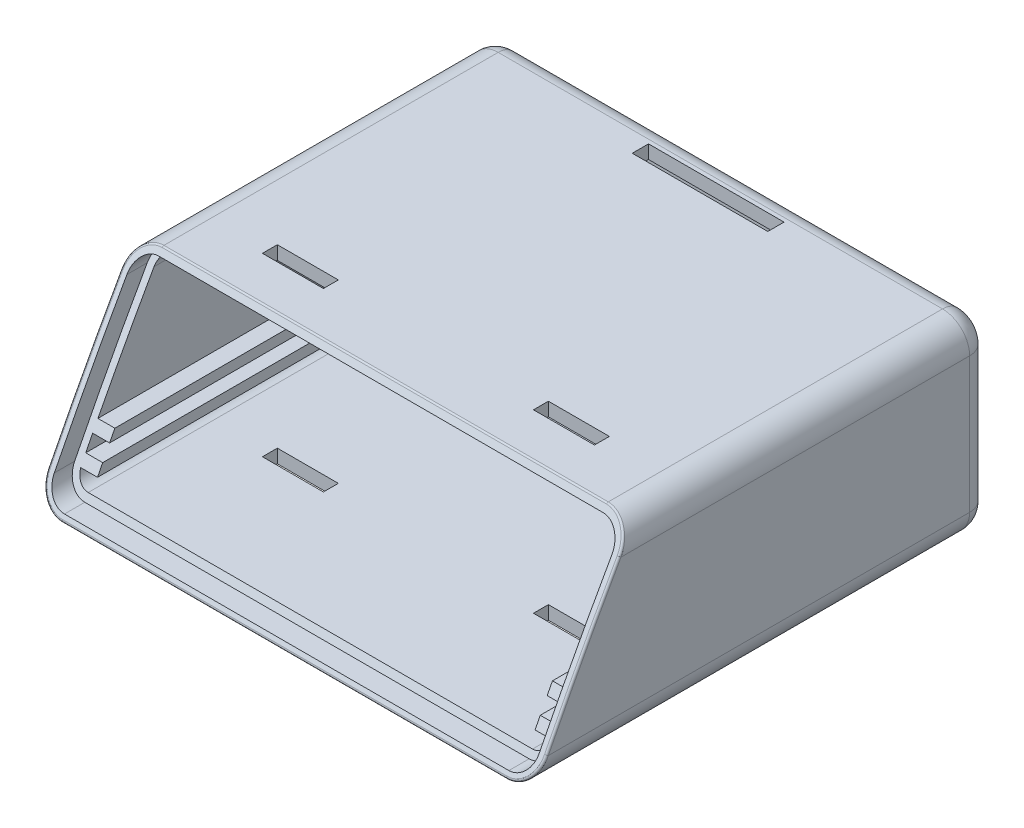
from build123d import *
from OCP.BRepAlgoAPI import BRepAlgoAPI_Cut
from OCP.TopTools import TopTools_ListOfShape

# Parameters (mm, degrees)
SKETCH1_W                = 73.58
SKETCH1_H                = 67.5
BOSS_EXTRUDE1_DEPTH      = 28
FILLET1_R                = 4
SHELL1_T                 = -2
CUT_EXTRUDE1_DEPTH       = 86.656750464
FILLET2_R                = 3
CUT_EXTRUDE3_REACH       = 162.173
CUT_EXTRUDE3_END_RADIUS  = 475
CUT_EXTRUDE3_START       = 80
FILLET3_R                = 0.3
BOSS_EXTRUDE2_REACH      = 82.024
BOSS_EXTRUDE2_END_RADIUS = 475
SKETCH5_W                = 2.5
SKETCH5_H                = 1.5
SKETCH6_W                = 14.3
SKETCH6_H                = 16.7
SKETCH6_W_2              = 11.05
SKETCH6_H_2              = 14.049996967
CUT_EXTRUDE4_DEPTH       = 2
SKETCH7_W                = 9
SKETCH7_H                = 2.2
CUT_EXTRUDE5_DEPTH       = 58.241301636
SKETCH8_W                = 20
SKETCH8_H                = 2.4
CUT_EXTRUDE6_DEPTH       = 2


with BuildPart() as part:
    # Sketch1 → Boss-Extrude1 (new body)
    with BuildSketch(Plane(origin=(0, 0, 0), x_dir=(1, 0, 0), z_dir=(0, 1, 0))):
        Rectangle(SKETCH1_W, SKETCH1_H)
    extrude(amount=BOSS_EXTRUDE1_DEPTH)

    # Fillet1
    fillet1_edges = [part.edges().sort_by_distance(p)[0] for p in [
        (-36.79, 28, 0),
        (36.79, 28, 0),
        (-36.79, 0, 0),
        (36.79, 0, 0),
    ]]
    fillet(fillet1_edges, radius=FILLET1_R)

    # Shell1
    shell1_openings = [part.faces().sort_by_distance(p)[0] for p in [
        (0, 14, 33.75),
    ]]
    offset(amount=SHELL1_T, openings=shell1_openings, kind=Kind.INTERSECTION)


with BuildPart() as cut_extrude1_tool:
    # Sketch2 → Cut-Extrude1 (new, through all)
    with BuildSketch(Plane.ZY.offset(36.79)):
        with BuildLine():
            Line((18.75, 28), (33.75, 28))
            Line((33.75, 28), (33.75, 0))
            ThreePointArc((33.75, 0), (26.484121584, 14.125422277), (18.75, 28))
        make_face()
    extrude(amount=-CUT_EXTRUDE1_DEPTH)


with BuildPart() as part_1:
    add(part.part)

    # Cut-Extrude1: cut by cut_extrude1_tool, with a tolerance
    cut_extrude1_stock = TopTools_ListOfShape()
    cut_extrude1_stock.Append(part_1.part.wrapped)
    cut_extrude1_tools = TopTools_ListOfShape()
    cut_extrude1_tools.Append(cut_extrude1_tool.part.wrapped)
    cut_extrude1_cut = BRepAlgoAPI_Cut()
    cut_extrude1_cut.SetArguments(cut_extrude1_stock)
    cut_extrude1_cut.SetTools(cut_extrude1_tools)
    cut_extrude1_cut.SetFuzzyValue(0.00001)
    cut_extrude1_cut.Build()
    add(Compound.cast(cut_extrude1_cut.Shape()).solids(), mode=Mode.REPLACE)

    # Fillet2
    fillet2_edges = [part_1.edges().sort_by_distance(p)[0] for p in [
        (0, 28, -33.75),
        (0, 0, -33.75),
        (-36.79, 14, -33.75),
        (36.79, 14, -33.75),
        (-35.618427125, 26.828427125, -33.75),
        (-35.618427125, 1.171572875, -33.75),
        (35.618427125, 1.171572875, -33.75),
        (35.618427125, 26.828427125, -33.75),
    ]]
    fillet(fillet2_edges, radius=FILLET2_R)

    # Cut-Extrude3: up to this cylinder (the profile starts outside it)
    cut_extrude3_end = Plane(origin=(0, -210.179748667, -395.218864179), z_dir=(-1, 0, 0)) * Cylinder(CUT_EXTRUDE3_END_RADIUS, 1275.346, mode=Mode.PRIVATE)
    # Sketch4 → Cut-Extrude3 (cut, up to the surface)
    with BuildSketch(Plane.XY.offset(-31.75).offset(CUT_EXTRUDE3_START), mode=Mode.PRIVATE) as cut_extrude3_sk1:
        with BuildLine():
            Line((32.79, 27), (-32.79, 27))
            ThreePointArc((-32.79, 27), (-34.911320344, 26.121320344), (-35.79, 24))
            Line((-35.79, 24), (-35.79, 4))
            ThreePointArc((-35.79, 4), (-34.911320344, 1.878679656), (-32.79, 1))
            Line((-32.79, 1), (32.79, 1))
            ThreePointArc((32.79, 1), (34.911320344, 1.878679656), (35.79, 4))
            Line((35.79, 4), (35.79, 24))
            ThreePointArc((35.79, 24), (34.911320344, 26.121320344), (32.79, 27))
        make_face()
        with BuildLine():
            Line((32.79, 26), (-32.79, 26))
            ThreePointArc((-32.79, 26), (-34.204213562, 25.414213562), (-34.79, 24))
            Line((-34.79, 24), (-34.79, 4))
            ThreePointArc((-34.79, 4), (-34.204213562, 2.585786438), (-32.79, 2))
            Line((-32.79, 2), (32.79, 2))
            ThreePointArc((32.79, 2), (34.204213562, 2.585786438), (34.79, 4))
            Line((34.79, 4), (34.79, 24))
            ThreePointArc((34.79, 24), (34.204213562, 25.414213562), (32.79, 26))
        make_face(mode=Mode.SUBTRACT)
    cut_extrude3_tool1 = extrude(cut_extrude3_sk1.sketch, amount=-CUT_EXTRUDE3_REACH, mode=Mode.PRIVATE) - cut_extrude3_end
    add(cut_extrude3_tool1.solids().sort_by_distance((0, 26.238443, 48.25))[0], mode=Mode.SUBTRACT)

    # Fillet3
    fillet3_edges = [part_1.edges().sort_by_distance(p)[0] for p in [
        (0, 0, 33.75),
        (-36.79, 14.0639546, 26.517044891),
        (35.714985447, 26.728453829, 19.484309952),
        (35.696759777, 1.252137621, 33.12988385),
        (-35.696759776, 1.252137622, 33.12988385),
        (-35.714985447, 26.728453829, 19.484309952),
        (36.79, 14.0639546, 26.517044891),
        (0, 28, 18.75),
    ]]
    fillet(fillet3_edges, radius=FILLET3_R)

    # Boss-Extrude2: up to this cylinder (the profile starts inside it)
    boss_extrude2_end = Plane(origin=(0, -210.179748667, -395.218864179), z_dir=(-1, 0, 0)) * Cylinder(BOSS_EXTRUDE2_END_RADIUS, 1182.128, mode=Mode.PRIVATE)
    # Sketch5 → Boss-Extrude2 (add, up to the surface)
    with BuildSketch(Plane.XY.offset(-31.75), mode=Mode.PRIVATE) as boss_extrude2_sk1:
        with Locations((33.54, 4.5)):
            Rectangle(SKETCH5_W, SKETCH5_H)
    boss_extrude2_tool1 = extrude(boss_extrude2_sk1.sketch, amount=BOSS_EXTRUDE2_REACH, mode=Mode.PRIVATE) & boss_extrude2_end
    add(boss_extrude2_tool1.solids().sort_by_distance((33.54, 4.5, -31.75))[0])
    # Sketch5 → Boss-Extrude2 (add, up to the surface)
    with BuildSketch(Plane.XY.offset(-31.75), mode=Mode.PRIVATE) as boss_extrude2_sk2:
        with Locations((33.54, 8)):
            Rectangle(SKETCH5_W, SKETCH5_H)
    boss_extrude2_tool2 = extrude(boss_extrude2_sk2.sketch, amount=BOSS_EXTRUDE2_REACH, mode=Mode.PRIVATE) & boss_extrude2_end
    add(boss_extrude2_tool2.solids().sort_by_distance((33.54, 8, -31.75))[0])
    # Sketch5 → Boss-Extrude2 (add, up to the surface)
    with BuildSketch(Plane.XY.offset(-31.75), mode=Mode.PRIVATE) as boss_extrude2_sk3:
        with Locations((-33.54, 8)):
            Rectangle(SKETCH5_W, SKETCH5_H)
    boss_extrude2_tool3 = extrude(boss_extrude2_sk3.sketch, amount=BOSS_EXTRUDE2_REACH, mode=Mode.PRIVATE) & boss_extrude2_end
    add(boss_extrude2_tool3.solids().sort_by_distance((-33.54, 8, -31.75))[0])
    # Sketch5 → Boss-Extrude2 (add, up to the surface)
    with BuildSketch(Plane.XY.offset(-31.75), mode=Mode.PRIVATE) as boss_extrude2_sk4:
        with Locations((-33.54, 4.5)):
            Rectangle(SKETCH5_W, SKETCH5_H)
    boss_extrude2_tool4 = extrude(boss_extrude2_sk4.sketch, amount=BOSS_EXTRUDE2_REACH, mode=Mode.PRIVATE) & boss_extrude2_end
    add(boss_extrude2_tool4.solids().sort_by_distance((-33.54, 4.5, -31.75))[0])

    # Sketch6 → Cut-Extrude4 (cut)
    with BuildSketch(Plane(origin=(0, 0, -33.75), x_dir=(-1, 0, 0), z_dir=(0, 0, -1))):
        with Locations((0, 10.35)):
            Rectangle(SKETCH6_W, SKETCH6_H)
        with Locations((26.425, 10.175001517)):
            Rectangle(SKETCH6_W_2, SKETCH6_H_2)
    extrude(amount=-CUT_EXTRUDE4_DEPTH, mode=Mode.SUBTRACT)

    # Sketch7 → Cut-Extrude5 (cut, through all)
    with BuildSketch(Plane(origin=(0, 28, 0), x_dir=(1, 0, 0), z_dir=(0, 1, 0))):
        with Locations((20, -11.23)):
            Rectangle(SKETCH7_W, SKETCH7_H)
        with Locations((-20, -11.23)):
            Rectangle(SKETCH7_W, SKETCH7_H)
    extrude(amount=-CUT_EXTRUDE5_DEPTH, mode=Mode.SUBTRACT)

    # Sketch8 → Cut-Extrude6 (cut)
    with BuildSketch(Plane(origin=(0, 28, 0), x_dir=(1, 0, 0), z_dir=(0, 1, 0))):
        with Locations((0, 28.95)):
            Rectangle(SKETCH8_W, SKETCH8_H)
    extrude(amount=-CUT_EXTRUDE6_DEPTH, mode=Mode.SUBTRACT)


solid = part_1.part
